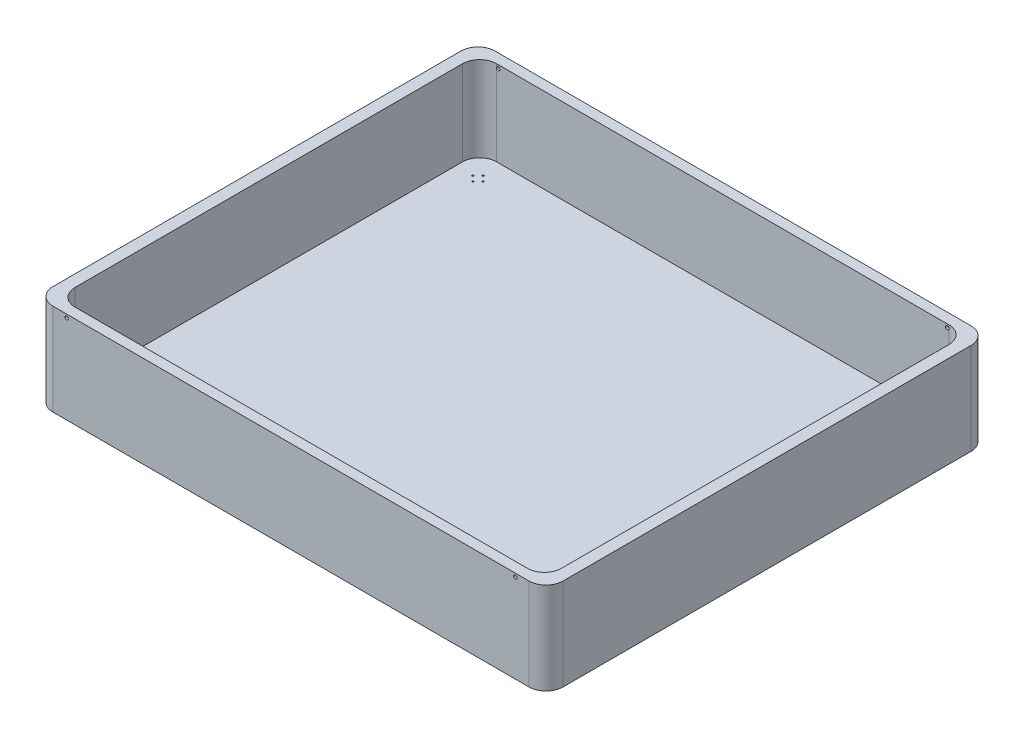
from build123d import *

# Parameters (mm, degrees)
EXTRUDE_1_DEPTH     = 20
EXTRUDE_2_DEPTH     = 250
SKETCH_3_R          = 2.5
CUT_EXTRUDE_1_DEPTH = 250
SKETCH_4_R          = 5
CUT_EXTRUDE_2_DEPTH = 1500


with BuildPart() as part:
    # Эскиз1 → Бобышка-Вытянуть1 (new body)
    with BuildSketch(Plane(origin=(0, 0, 0), x_dir=(1, 0, 0), z_dir=(0, 1, 0))):
        with BuildLine():
            Line((-700, -650), (700, -650))
            ThreePointArc((700, -650), (735.355339059, -635.355339059), (750, -600))
            Line((750, -600), (750, 600))
            ThreePointArc((750, 600), (735.355339059, 635.355339059), (700, 650))
            Line((700, 650), (-700, 650))
            ThreePointArc((-700, 650), (-735.355339059, 635.355339059), (-750, 600))
            Line((-750, 600), (-750, -600))
            ThreePointArc((-750, -600), (-735.355339059, -635.355339059), (-700, -650))
        make_face()
    extrude(amount=EXTRUDE_1_DEPTH)

    # Эскиз2 → Бобышка-Вытянуть2 (add)
    with BuildSketch(Plane(origin=(0, 20, 0), x_dir=(1, 0, 0), z_dir=(0, 1, 0))):
        with BuildLine():
            Line((700, -650), (-700, -650))
            ThreePointArc((-700, -650), (-735.355339059, -635.355339059), (-750, -600))
            Line((-750, -600), (-750, 600))
            ThreePointArc((-750, 600), (-735.355339059, 635.355339059), (-700, 650))
            Line((-700, 650), (700, 650))
            ThreePointArc((700, 650), (735.355339059, 635.355339059), (750, 600))
            Line((750, 600), (750, -600))
            ThreePointArc((750, -600), (735.355339059, -635.355339059), (700, -650))
        make_face()
        with BuildLine():
            Line((665.384615385, -620), (-665.384615385, -620))
            ThreePointArc((-665.384615385, -620), (-700.739954444, -605.355339059), (-715.384615385, -570))
            Line((-715.384615385, -570), (-715.384615385, 570))
            ThreePointArc((-715.384615385, 570), (-700.739954444, 605.355339059), (-665.384615385, 620))
            Line((-665.384615385, 620), (665.384615385, 620))
            ThreePointArc((665.384615385, 620), (700.739954444, 605.355339059), (715.384615385, 570))
            Line((715.384615385, 570), (715.384615385, -570))
            ThreePointArc((715.384615385, -570), (700.739954444, -605.355339059), (665.384615385, -620))
        make_face(mode=Mode.SUBTRACT)
    extrude(amount=EXTRUDE_2_DEPTH)

    # Эскиз3 → Вырез-Вытянуть1 (cut)
    with BuildSketch(Plane.XZ):
        with Locations((635, -550)):
            Circle(SKETCH_3_R)
        with Locations((650, -535)):
            Circle(SKETCH_3_R)
        with Locations((-635, -550)):
            Circle(SKETCH_3_R)
        with Locations((650, 535)):
            Circle(SKETCH_3_R)
        with Locations((-650, -535)):
            Circle(SKETCH_3_R)
        with Locations((635, 550)):
            Circle(SKETCH_3_R)
        with Locations((-650, 535)):
            Circle(SKETCH_3_R)
        with Locations((-635, 550)):
            Circle(SKETCH_3_R)
        with Locations((-665, 550)):
            Circle(SKETCH_3_R)
        with Locations((-650, 565)):
            Circle(SKETCH_3_R)
        with Locations((665, 550)):
            Circle(SKETCH_3_R)
        with Locations((650, 565)):
            Circle(SKETCH_3_R)
        with Locations((650, -565)):
            Circle(SKETCH_3_R)
        with Locations((665, -550)):
            Circle(SKETCH_3_R)
        with Locations((-665, -550)):
            Circle(SKETCH_3_R)
        with Locations((-650, -565)):
            Circle(SKETCH_3_R)
    extrude(amount=-CUT_EXTRUDE_1_DEPTH, mode=Mode.SUBTRACT)

    # Эскиз4 → Вырез-Вытянуть2 (cut)
    with BuildSketch(Plane(origin=(0, 0, -650), x_dir=(-1, 0, 0), z_dir=(0, 0, -1))):
        with Locations((660, 260)):
            Circle(SKETCH_4_R)
    cut_extrude_2 = extrude(amount=-CUT_EXTRUDE_2_DEPTH, mode=Mode.SUBTRACT)

    # Зеркальное отражение1: Вырез-Вытянуть2 across plane
    add(cut_extrude_2.mirror(Plane.ZY), mode=Mode.SUBTRACT)


solid = part.part
